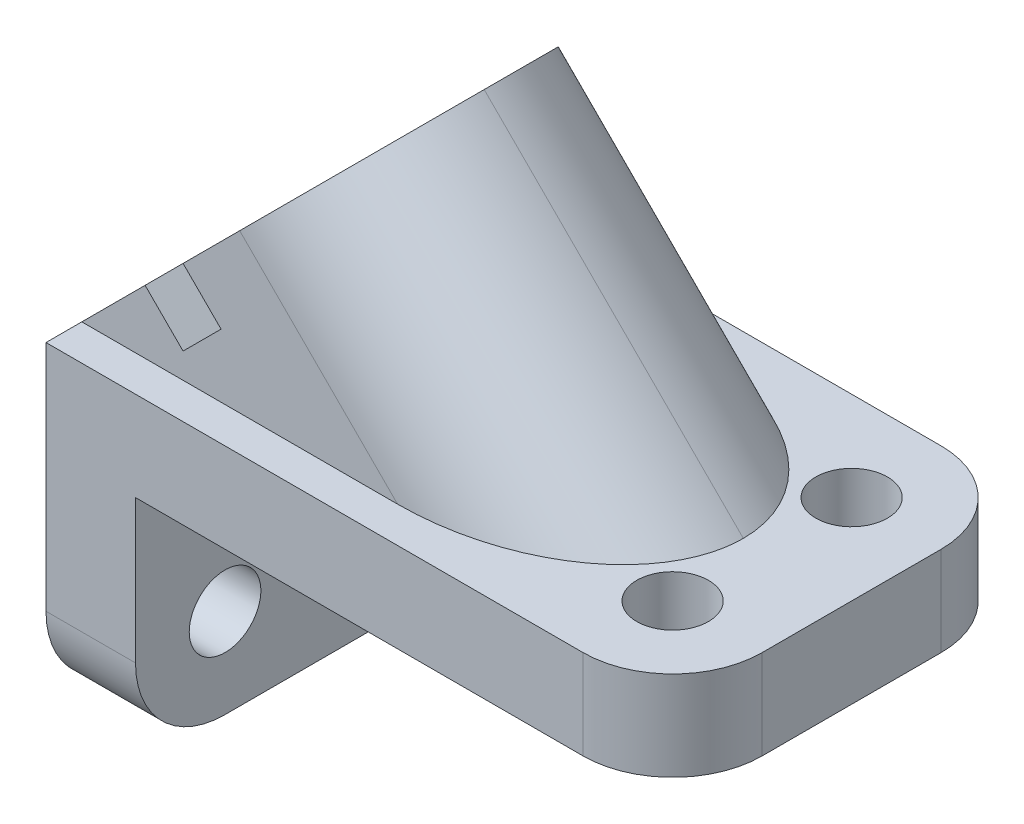
from build123d import *

# Parameters (mm, degrees)
SKETCH1_W           = 150
SKETCH1_H           = 100
BOSS_EXTRUDE1_DEPTH = 25
SKETCH2_W           = 100
SKETCH2_H           = 90
BOSS_EXTRUDE2_DEPTH = 25
FILLET1_R           = 25
BOSS_EXTRUDE3_REACH = 196.068
SKETCH5_W           = 80
SKETCH5_H           = 102.358362639
SKETCH6_W           = 80
SKETCH6_H           = 15
CUT_EXTRUDE1_DEPTH  = 15
SKETCH7_R           = 15
CUT_EXTRUDE2_DEPTH  = 195.068286951
SKETCH8_R           = 10
CUT_EXTRUDE3_DEPTH  = 144.527000944
SKETCH9_R           = 10
CUT_EXTRUDE4_DEPTH  = 207.415919487
FILLET4_R           = 40


with BuildPart() as part:
    # Sketch1 → Boss-Extrude1 (new body)
    with BuildSketch(Plane(origin=(0, 0, 0), x_dir=(1, 0, 0), z_dir=(0, 1, 0))):
        Rectangle(SKETCH1_W, SKETCH1_H)
    extrude(amount=BOSS_EXTRUDE1_DEPTH)

    # Sketch2 → Boss-Extrude2 (add)
    with BuildSketch(Plane.ZY.offset(75)):
        with Locations((0, -20)):
            Rectangle(SKETCH2_W, SKETCH2_H)
    extrude(amount=BOSS_EXTRUDE2_DEPTH)

    # Fillet1
    fillet1_edges = [part.edges().sort_by_distance(p)[0] for p in [
        (-87.5, -65, -50),
        (-87.5, -65, 50),
        (75, 12.5, 50),
        (75, 12.5, -50),
    ]]
    fillet(fillet1_edges, radius=FILLET1_R)

    # Sketch5 → Boss-Extrude3 (add, up to next)
    with BuildSketch(Plane(origin=(-62.5, 62.5, 0), x_dir=(0, 0, -1), z_dir=(0.7071067811865438, -0.7071067811865512, 0)), mode=Mode.PRIVATE) as boss_extrude3_sk1:
        with Locations((0, -1.85382727)):
            Rectangle(SKETCH5_W, SKETCH5_H)
    boss_extrude3_tool1 = extrude(boss_extrude3_sk1.sketch, amount=BOSS_EXTRUDE3_REACH, mode=Mode.PRIVATE) - part.part
    add(boss_extrude3_tool1.solids().sort_by_distance((-63.810854, 61.189146, 0))[0])

    # Sketch6 → Cut-Extrude1 (cut)
    with BuildSketch(Plane(origin=(-62.5, 62.5, 0), x_dir=(0, 0, 1), z_dir=(-0.7071067811865438, 0.7071067811865513, 0))):
        with Locations((0, -20.533008589)):
            Rectangle(SKETCH6_W, SKETCH6_H)
    extrude(amount=-CUT_EXTRUDE1_DEPTH, mode=Mode.SUBTRACT)

    # Sketch7 → Cut-Extrude2 (cut, through all)
    with BuildSketch(Plane(origin=(-62.5, 62.5, 0), x_dir=(0.7071067811865513, 0.7071067811865438, 0), z_dir=(-0.7071067811865438, 0.7071067811865513, 0))):
        with Locations(Location((21.966991411, 0, 0), (0, 0, 180))):
            Circle(SKETCH7_R)
    extrude(amount=-CUT_EXTRUDE2_DEPTH, mode=Mode.SUBTRACT)

    # Sketch8 → Cut-Extrude3 (cut, through all)
    with BuildSketch(Plane(origin=(0, 25, 0), x_dir=(1, 0, 0), z_dir=(0, 1, 0))):
        with Locations(Location((50, 25, 0), (0, 0, 270))):
            Circle(SKETCH8_R)
        with Locations(Location((50, -25, 0), (0, 0, 270))):
            Circle(SKETCH8_R)
    extrude(amount=-CUT_EXTRUDE3_DEPTH, mode=Mode.SUBTRACT)

    # Sketch9 → Cut-Extrude4 (cut, through all)
    with BuildSketch(Plane.ZY.offset(100)):
        with Locations((-25, -40)):
            Circle(SKETCH9_R)
        with Locations((25, -40)):
            Circle(SKETCH9_R)
    extrude(amount=-CUT_EXTRUDE4_DEPTH, mode=Mode.SUBTRACT)

    # Fillet4
    # the kernel refuses this fillet: 40 mm, written as the material it takes off along each edge
    with BuildSketch(Plane(origin=(-98.332385785, 168.088970452, -40), x_dir=(-0.7071067811865511, -0.7071067811865437, 0), z_dir=(0.7071067811865438, -0.7071067811865512, 0))) as fillet4_piece_1_section:
        with BuildLine():
            CenterArc((FILLET4_R, -FILLET4_R), FILLET4_R, 90, 90)
            Line((0, -FILLET4_R), (0, 0))
            Line((0, 0), (FILLET4_R, 0))
        make_face()
    fillet4_piece_1 = extrude(amount=302.358362639, mode=Mode.PRIVATE)
    fillet4_piece_1 = split(fillet4_piece_1, bisect_by=Plane(origin=(-0.418025546, 25, -30.730970788), z_dir=(0, 1, 0)), keep=Keep.TOP, mode=Mode.PRIVATE)
    add(fillet4_piece_1, mode=Mode.SUBTRACT)
    with BuildSketch(Plane(origin=(-98.332385785, 168.088970452, 40), x_dir=(0, 0, -1), z_dir=(0.7071067811865438, -0.7071067811865512, 0))) as fillet4_piece_2_section:
        with BuildLine():
            CenterArc((FILLET4_R, -FILLET4_R), FILLET4_R, 90, 90)
            Line((0, -FILLET4_R), (0, 0))
            Line((0, 0), (FILLET4_R, 0))
        make_face()
    fillet4_piece_2 = extrude(amount=302.358362639, mode=Mode.PRIVATE)
    fillet4_piece_2 = split(fillet4_piece_2, bisect_by=Plane(origin=(-0.418025546, 25, 30.730970789), z_dir=(0, 1, 0)), keep=Keep.TOP, mode=Mode.PRIVATE)
    add(fillet4_piece_2, mode=Mode.SUBTRACT)


solid = part.part
